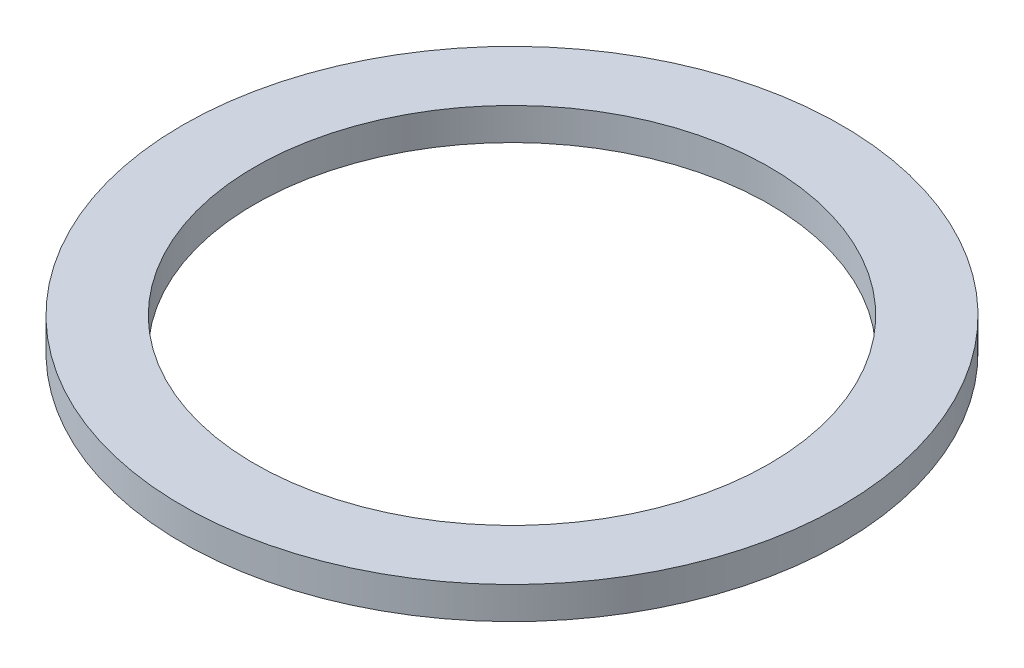
from build123d import *

# Parameters (mm, degrees)
SKETCH1_W = 28.575
SKETCH1_H = 12.7


with BuildPart() as part:
    # Sketch1 → Revolve1 (revolve)
    with BuildSketch(Plane.XY):
        with Locations((115.8875, 148.342101803)):
            Rectangle(SKETCH1_W, SKETCH1_H)
    revolve(axis=Axis((1e-09, -200000, 0), (0, 1, 0)))


solid = part.part
